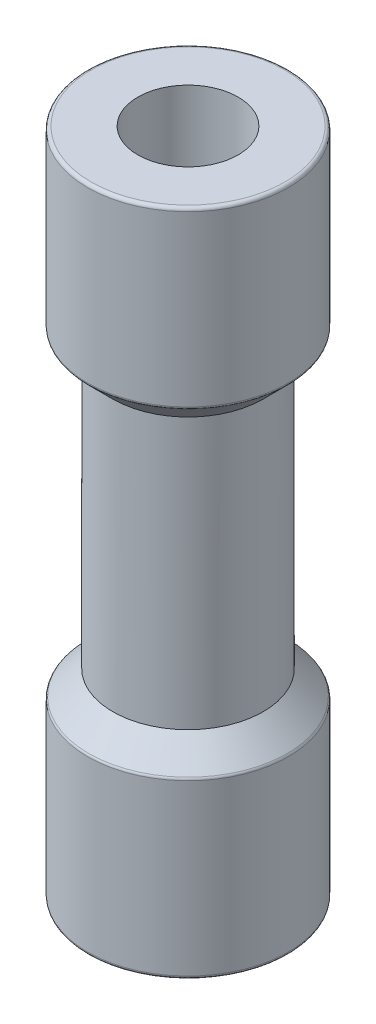
from build123d import *

# Parameters (mm, degrees)
SKETCH_1_R      = 3
SKETCH_1_R_2    = 1.5
EXTRUDE_1_DEPTH = 6
SKETCH_2_R      = 2.25
SKETCH_2_R_2    = 1.5
EXTRUDE_2_DEPTH = 8
SKETCH_3_R      = 3
SKETCH_3_R_2    = 1.5
EXTRUDE_3_DEPTH = 6
CHAMFER_1_SIZE  = 0.8
FILLET_1_R      = 0.1


with BuildPart() as part:
    # 草图1 → 凸台-拉伸1 (new body)
    with BuildSketch(Plane(origin=(0, 0, 0), x_dir=(1, 0, 0), z_dir=(0, 1, 0))):
        with Locations(Location((0, 0, 0), (0, 0, 270))):
            Circle(SKETCH_1_R)
        with Locations(Location((0, 0, 0), (0, 0, 270))):
            Circle(SKETCH_1_R_2, mode=Mode.SUBTRACT)
    extrude(amount=EXTRUDE_1_DEPTH)

    # 草图2 → 凸台-拉伸2 (add)
    with BuildSketch(Plane(origin=(0, 6, 0), x_dir=(1, 0, 0), z_dir=(0, 1, 0))):
        with Locations(Location((0, 0, 0), (0, 0, 270))):
            Circle(SKETCH_2_R)
        with Locations(Location((0, 0, 0), (0, 0, 270))):
            Circle(SKETCH_2_R_2, mode=Mode.SUBTRACT)
    extrude(amount=EXTRUDE_2_DEPTH)

    # 草图3 → 凸台-拉伸3 (add)
    with BuildSketch(Plane(origin=(0, 14, 0), x_dir=(1, 0, 0), z_dir=(0, 1, 0))):
        with Locations(Location((0, 0, 0), (0, 0, 270))):
            Circle(SKETCH_3_R)
        with Locations(Location((0, 0, 0), (0, 0, 270))):
            Circle(SKETCH_3_R_2, mode=Mode.SUBTRACT)
    extrude(amount=EXTRUDE_3_DEPTH)

    # 倒角1
    # the kernel refuses this chamfer: 0.8 mm, written as the material it takes off along each edge
    with BuildSketch(Plane(origin=(0, 6, 0), x_dir=(0, 0, 1), z_dir=(-1, 0, 0))) as chamfer_1_piece_1_section:
        Polygon((3, -CHAMFER_1_SIZE), (3 - CHAMFER_1_SIZE, 0), (3, 0), align=None)
    chamfer_1_piece_1 = revolve(axis=Axis((0, 6, 0), (0, 1, 0)), mode=Mode.PRIVATE)
    chamfer_1_piece_1 = chamfer_1_piece_1 - Plane(origin=(0, 5.57653803, 0), x_dir=(0, 0, 1), z_dir=(0, -1, 0)) * Cylinder(2.25, 12, mode=Mode.PRIVATE)
    add(chamfer_1_piece_1, mode=Mode.SUBTRACT)
    with BuildSketch(Plane(origin=(0, 14, 0), x_dir=(0, 0, 1), z_dir=(-1, 0, 0))) as chamfer_1_piece_2_section:
        Polygon((3 - CHAMFER_1_SIZE, 0), (3, CHAMFER_1_SIZE), (3, 0), align=None)
    chamfer_1_piece_2 = revolve(axis=Axis((0, 14, 0), (0, 1, 0)), mode=Mode.PRIVATE)
    chamfer_1_piece_2 = chamfer_1_piece_2 - Plane(origin=(0, 14.42346197, 0), x_dir=(0, 0, 1), z_dir=(0, -1, 0)) * Cylinder(2.25, 13, mode=Mode.PRIVATE)
    add(chamfer_1_piece_2, mode=Mode.SUBTRACT)

    # 圆角1
    fillet_1_edges = [part.edges().sort_by_distance(p)[0] for p in [
        (0, 20, -3),
        (0, 0, -3),
        (0, 5.2, -3),
        (0, 14.8, -3),
    ]]
    fillet(fillet_1_edges, radius=FILLET_1_R)


solid = part.part
